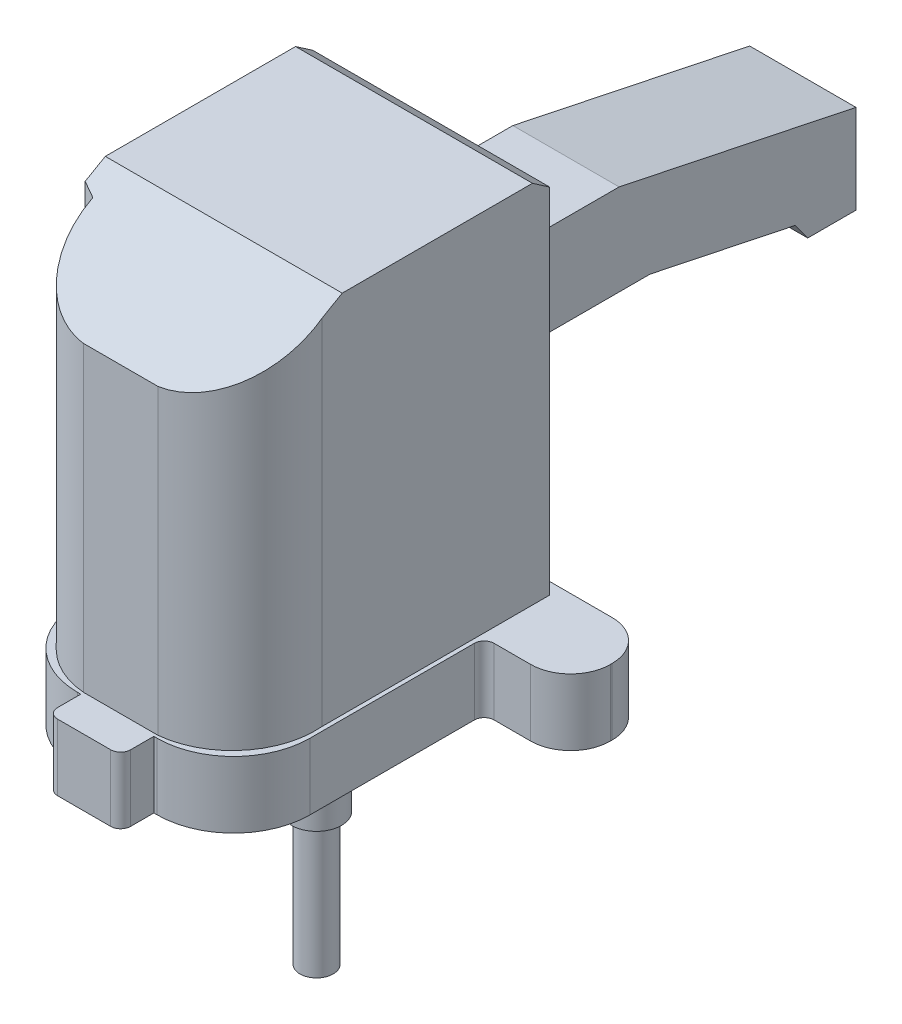
from build123d import *

# Parameters (mm, degrees)
SKETCH_1_R               = 2
SKETCH_1_R_2             = 10
EXTRUDE_1_DEPTH          = 20
SKETCH_2_R               = 25
SKETCH_2_R_2             = 12
EXTRUDE_2_DEPTH          = 2
EXTRUDE_3_DEPTH          = 110
CUT_EXTRUDE_5_DEPTH      = 206.111615616
CUT_EXTRUDE_5_DEPTH_BACK = 206.111615616
SKETCH_4_OUTSIDE_W       = 274.729
SKETCH_4_OUTSIDE_H       = 190.272
SKETCH_5_R               = 7.5
EXTRUDE_4_DEPTH          = 55
SKETCH_6_R               = 5
EXTRUDE_5_DEPTH          = 40


with BuildPart() as part:
    # Эскиз1 → Бобышка-Вытянуть1 (new body)
    with BuildSketch(Plane(origin=(0, 0, 0), x_dir=(1, 0, 0), z_dir=(0, 1, 0))):
        with BuildLine():
            Line((35, 12.5), (35, -37))
            ThreePointArc((35, -37), (28.263455967, -53.263455967), (12, -60))
            Line((12, -60), (11, -60))
            Line((11, -60), (11, -67))
            ThreePointArc((11, -67), (10.121320344, -69.121320344), (8, -70))
            Line((8, -70), (-8, -70))
            ThreePointArc((-8, -70), (-10.121320344, -69.121320344), (-11, -67))
            Line((-11, -67), (-11, -60))
            Line((-11, -60), (-12, -60))
            ThreePointArc((-12, -60), (-28.263455967, -53.263455967), (-35, -37))
            Line((-35, -37), (-35, -35))
            Line((-35, -35), (-37, -35))
            ThreePointArc((-37, -35), (-39.121320344, -34.121320344), (-40, -32))
            Line((-40, -32), (-40, 12.5))
            ThreePointArc((-40, 12.5), (-40.878679656, 14.621320344), (-43, 15.5))
            Line((-43, 15.5), (-49, 15.5))
            ThreePointArc((-49, 15.5), (-57.485281374, 19.014718626), (-61, 27.5))
            Line((-61, 27.5), (-61, 28))
            ThreePointArc((-61, 28), (-57.485281374, 36.485281374), (-49, 40))
            Line((-49, 40), (49, 40))
            ThreePointArc((49, 40), (57.485281374, 36.485281374), (61, 28))
            Line((61, 28), (61, 27.5))
            ThreePointArc((61, 27.5), (57.485281374, 19.014718626), (49, 15.5))
            Line((49, 15.5), (38, 15.5))
            ThreePointArc((38, 15.5), (35.878679656, 14.621320344), (35, 12.5))
        make_face()
        with Locations((27.5, 27.5)):
            Circle(SKETCH_1_R, mode=Mode.SUBTRACT)
        with Locations((-27.5, 27.5)):
            Circle(SKETCH_1_R, mode=Mode.SUBTRACT)
        with Locations((-27.5, -27.5)):
            Circle(SKETCH_1_R, mode=Mode.SUBTRACT)
        with Locations((27.5, -27.5)):
            Circle(SKETCH_1_R, mode=Mode.SUBTRACT)
        Circle(SKETCH_1_R_2, mode=Mode.SUBTRACT)
    extrude(amount=EXTRUDE_1_DEPTH)

    # Эскиз2 → Бобышка-Вытянуть2 (add)
    with BuildSketch(Plane.XZ):
        Circle(SKETCH_2_R)
        Circle(SKETCH_2_R_2, mode=Mode.SUBTRACT)
    extrude(amount=EXTRUDE_2_DEPTH)

    # Эскиз3 → Бобышка-Вытянуть3 (add)
    with BuildSketch(Plane(origin=(0, 20, 0), x_dir=(1, 0, 0), z_dir=(0, 1, 0))):
        with BuildLine():
            Line((-37.583733624, -32.103535028), (-37.583733624, 36.457416544))
            Line((-37.583733624, 36.457416544), (-16, 36.457416544))
            Line((-16, 36.457416544), (-16, 146.457416544))
            Line((-16, 146.457416544), (16, 146.457416544))
            Line((16, 146.457416544), (16, 36.457416544))
            Line((16, 36.457416544), (33.766635678, 36.457416544))
            Line((33.766635678, 36.457416544), (33.766635678, -32.103535028))
            ThreePointArc((33.766635678, -32.103535028), (28.080470389, -50.220903637), (11.304482379, -59.11684357))
            Line((11.304482379, -59.11684357), (-11, -59.11684357))
            ThreePointArc((-11, -59.11684357), (-27.23731375, -51.101673534), (-33.326201299, -34.048264581))
            Line((-33.326201299, -34.048264581), (-37.583733624, -32.103535028))
        make_face()
    extrude(amount=EXTRUDE_3_DEPTH)

    # Эскиз4 outside → Вырез-Вытянуть5 (cut, two sides: drawn at the far end of the back side and taken through both)
    with BuildSketch(Plane(origin=(0, 0, 0), x_dir=(0, 0, -1), z_dir=(1, 0, 0)).offset(-CUT_EXTRUDE_5_DEPTH_BACK)):
        with Locations((38.2285, 64)):
            Rectangle(SKETCH_4_OUTSIDE_W, SKETCH_4_OUTSIDE_H)
        Polygon((-59.11684357, 111.009140669), (-59.11684357, 20), (-70, 20), (-70, 0), (-25.61704501, 0), (-25.61704501, -2.465693048), (25.5, -2.465693048), (25.5, 0), (40, 0), (40, 20), (36.457416544, 20), (36.457416544, 70.826498743), (84.412407161, 70.826498743), (128.193178806, 61.67378586), (131.933723793, 56.499947934), (146.457416544, 56.499947934), (146.457416544, 83.32776512), (75.121913518, 98.241010205), (43.39244845, 98.241010205), (36.457416544, 102.079664685), (36.457416544, 126.416047598), (31.26241492, 130), (-26.036858243, 130), align=None, mode=Mode.SUBTRACT)
    extrude(amount=CUT_EXTRUDE_5_DEPTH + CUT_EXTRUDE_5_DEPTH_BACK, mode=Mode.SUBTRACT)

    # Эскиз5 → Бобышка-Вытянуть4 (add)
    with BuildSketch(Plane.XZ.offset(-20)):
        Circle(SKETCH_5_R)
    extrude(amount=EXTRUDE_4_DEPTH)

    # Эскиз6 → Бобышка-Вытянуть5 (add)
    with BuildSketch(Plane.XZ.offset(35)):
        Circle(SKETCH_6_R)
    extrude(amount=EXTRUDE_5_DEPTH)


solid = part.part
